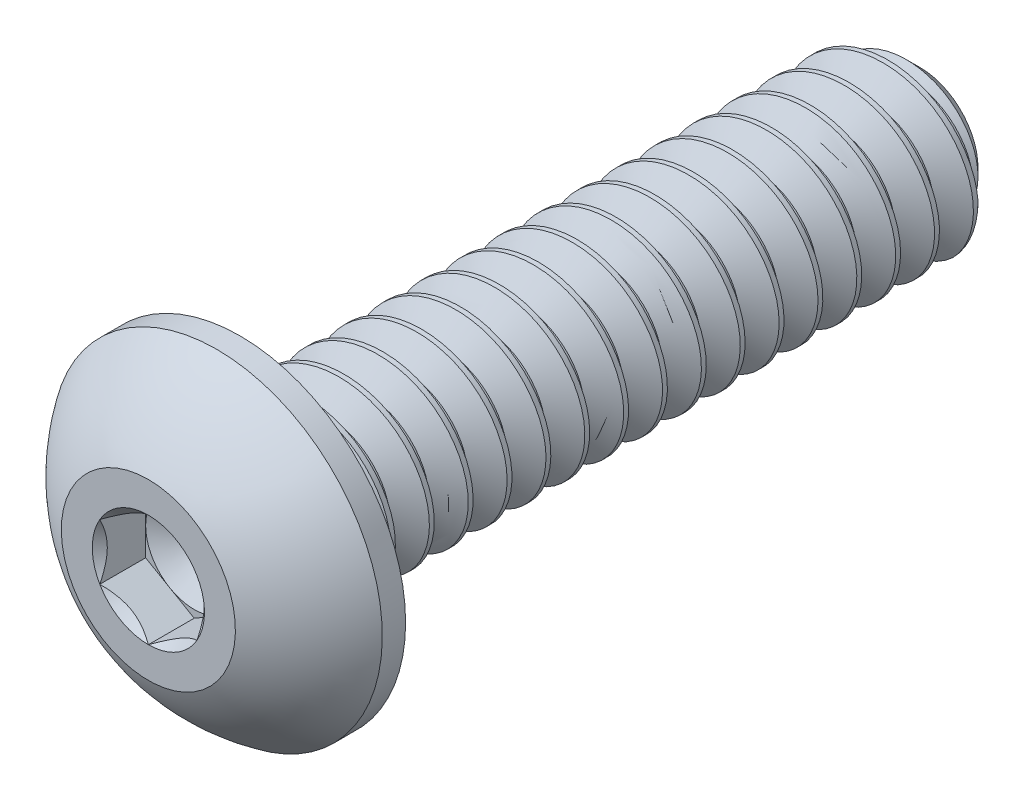
from build123d import *

# Parameters (mm, degrees)
SKETCH1_W          = 11.1125
SKETCH1_H          = 1.4224
CHAMFER1_SIZE      = 0.47625
CUT_SWEEP1_PITCH   = 0.635
SKETCH4_R          = 2.7051
EXTRUDE1_DEPTH     = 1.4986
CUT_EXTRUDE1_DEPTH = 0.7493
SKETCH7_R          = 0.916543552
CUT_EXTRUDE4_DEPTH = 0.7493
CUT_EXTRUDE4_DRAFT = -45
SKETCH8_R          = 0.79375
CUT_EXTRUDE5_DEPTH = 0.249766667
CUT_EXTRUDE5_DRAFT = -60


with BuildPart() as part:
    # Sketch1 → Revolve1 (revolve)
    with BuildSketch(Plane(origin=(0, 0, 0), x_dir=(0, 0, -1), z_dir=(1, 0, 0))):
        with Locations((5.55625, 0.7112)):
            Rectangle(SKETCH1_W, SKETCH1_H)
    revolve(axis=Axis((0, 0, 0), (0, 0, 1)))

    # Chamfer1
    chamfer1_edges = [part.edges().sort_by_distance(p)[0] for p in [
        (0, -1.4224, -11.1125),
    ]]
    chamfer(chamfer1_edges, length=CHAMFER1_SIZE)

    # Cut-Sweep1: arcs per turn and ends read off the stored shape
    # Cut-Sweep1: the profile of Sketch10 profile screwed along a right-hand helix through 22.5 turns, 6 arcs to a turn; built about Z, then put on its axis
    cut_sweep1_z = Axis((0, 0, 0), (0, 0, 1))
    cut_sweep1_corners = [(1.4227, 0, -0.079201795), (1.4227, 0, -0.635173205), (1.009955401, 0, -0.396875), (1.009955401, 0, -0.3175)]
    with BuildLine(mode=Mode.PRIVATE) as cut_sweep1_profile:
        Line(cut_sweep1_corners[0], cut_sweep1_corners[1])
        Line(cut_sweep1_corners[1], cut_sweep1_corners[2])
        Line(cut_sweep1_corners[2], cut_sweep1_corners[3])
        Line(cut_sweep1_corners[3], cut_sweep1_corners[0])
    cut_sweep1_cap = Face(cut_sweep1_profile.wire())
    cut_sweep1_turn_angles = [0, 30, 60, 90, 120, 150, 180, 210, 240, 270, 300, 330, 360]
    cut_sweep1_turn_weights = [1, 0.8660254037844387, 1, 0.8660254037844387, 1, 0.8660254037844387, 1, 0.8660254037844387, 1, 0.8660254037844387, 1, 0.8660254037844387, 1]
    cut_sweep1_turn_rails = [Edge.make_bspline([Vector(p[0], p[1], 0).rotate(cut_sweep1_z, cut_sweep1_turn_angles[k]) / cut_sweep1_turn_weights[k] + Vector(0, 0, p[2] + CUT_SWEEP1_PITCH * cut_sweep1_turn_angles[k] / 360) for k in range(13)], [0, 0, 0, 1, 1, 2, 2, 3, 3, 4, 4, 5, 5, 6, 6, 6], 2, cut_sweep1_turn_weights) for p in cut_sweep1_corners]
    cut_sweep1_turn_sides = [Face.make_surface_from_curves(cut_sweep1_turn_rails[p[0]], cut_sweep1_turn_rails[p[1]]) for p in [(0, 1), (1, 2), (2, 3), (3, 0)]]
    cut_sweep1_last_angles = [7920, 7950, 7980, 8010, 8040, 8070, 8100]
    cut_sweep1_last_weights = [1, 0.8660254037844387, 1, 0.8660254037844387, 1, 0.8660254037839783, 1]
    cut_sweep1_last_rails = [Edge.make_bspline([Vector(p[0], p[1], 0).rotate(cut_sweep1_z, cut_sweep1_last_angles[k]) / cut_sweep1_last_weights[k] + Vector(0, 0, p[2] + CUT_SWEEP1_PITCH * cut_sweep1_last_angles[k] / 360) for k in range(7)], [0, 0, 0, 1, 1, 2, 2, 3, 3, 3], 2, cut_sweep1_last_weights) for p in cut_sweep1_corners]
    cut_sweep1_last_sides = [Face.make_surface_from_curves(cut_sweep1_last_rails[p[0]], cut_sweep1_last_rails[p[1]]) for p in [(0, 1), (1, 2), (2, 3), (3, 0)]]
    cut_sweep1 = Plane(origin=(0, 0, -11.1125), x_dir=(0.7071067811865488, 0.7071067811865464, 0), z_dir=(0, 0, 1)) * Solid(Shell([*[p.moved(Location((0, 0, CUT_SWEEP1_PITCH * i))) for i in range(22) for p in cut_sweep1_turn_sides], *cut_sweep1_last_sides, cut_sweep1_cap, cut_sweep1_cap.rotate(cut_sweep1_z, 8100).moved(Location((0, 0, CUT_SWEEP1_PITCH * 8100 / 360)))]))
    add(cut_sweep1, mode=Mode.SUBTRACT)

    # Sketch4 → Extrude1 (add)
    with BuildSketch(Plane.XY):
        Circle(SKETCH4_R)
    extrude(amount=EXTRUDE1_DEPTH)

    # Sketch9 → Cut-Revolve3 (revolve, cut)
    with BuildSketch(Plane(origin=(0, 0, 0), x_dir=(0, 0, -1), z_dir=(1, 0, 0)), mode=Mode.PRIVATE) as cut_revolve3_sk:
        with BuildLine():
            Line((0, 2.7051), (-0.381, 2.7051))
            ThreePointArc((-0.381, 2.7051), (-1.025093234, 2.138064897), (-1.4986, 1.4224))
            Line((-1.4986, 1.4224), (-1.8796, 1.4224))
            Line((-1.8796, 1.4224), (-1.8796, 3.0861))
            Line((-1.8796, 3.0861), (0, 3.0861))
            Line((0, 3.0861), (0, 2.7051))
        make_face()
    revolve(cut_revolve3_sk.sketch.rotate(Axis((0, 0, 0), (0, 0, 1)), 170.90536533), axis=Axis((0, 0, 0), (0, 0, 1)), mode=Mode.SUBTRACT)

    # Sketch6 → Cut-Extrude1 (cut)
    with BuildSketch(Plane.XY.offset(1.4986)):
        Polygon((0, -0.916543552), (0.79375, -0.458271776), (0.79375, 0.458271776), (0, 0.916543552), (-0.79375, 0.458271776), (-0.79375, -0.458271776), align=None)
    extrude(amount=-CUT_EXTRUDE1_DEPTH, mode=Mode.SUBTRACT)


with BuildPart() as cut_extrude4_tool:
    # Sketch7 → Cut-Extrude4 (with draft: the straight prism first)
    with BuildSketch(Plane.XY.offset(1.4986)):
        Circle(SKETCH7_R)
    extrude(amount=-CUT_EXTRUDE4_DEPTH)
    # Cut-Extrude4: the draft: its side faces are tilted about the plane it starts from
    cut_extrude4_sides = [cut_extrude4_tool.faces().sort_by_distance(p)[0] for p in [
        (-0.916543552, 0, 1.12395),
    ]]
    draft(cut_extrude4_sides, Plane.XY.offset(1.4986), CUT_EXTRUDE4_DRAFT)


with BuildPart() as part_1:
    add(part.part)

    # Cut-Extrude4: cut by cut_extrude4_tool
    add(cut_extrude4_tool.part, mode=Mode.SUBTRACT)


with BuildPart() as cut_extrude5_tool:
    # Sketch8 → Cut-Extrude5 (with draft: the straight prism first)
    with BuildSketch(Plane.XY.offset(0.7493)):
        Circle(SKETCH8_R)
    extrude(amount=-CUT_EXTRUDE5_DEPTH)
    # Cut-Extrude5: the draft: its side faces are tilted about the plane it starts from
    cut_extrude5_sides = [cut_extrude5_tool.faces().sort_by_distance(p)[0] for p in [
        (-0.79375, 0, 0.624416667),
    ]]
    draft(cut_extrude5_sides, Plane.XY.offset(0.7493), CUT_EXTRUDE5_DRAFT)


with BuildPart() as part_2:
    add(part_1.part)

    # Cut-Extrude5: cut by cut_extrude5_tool
    add(cut_extrude5_tool.part, mode=Mode.SUBTRACT)


solid = part_2.part
